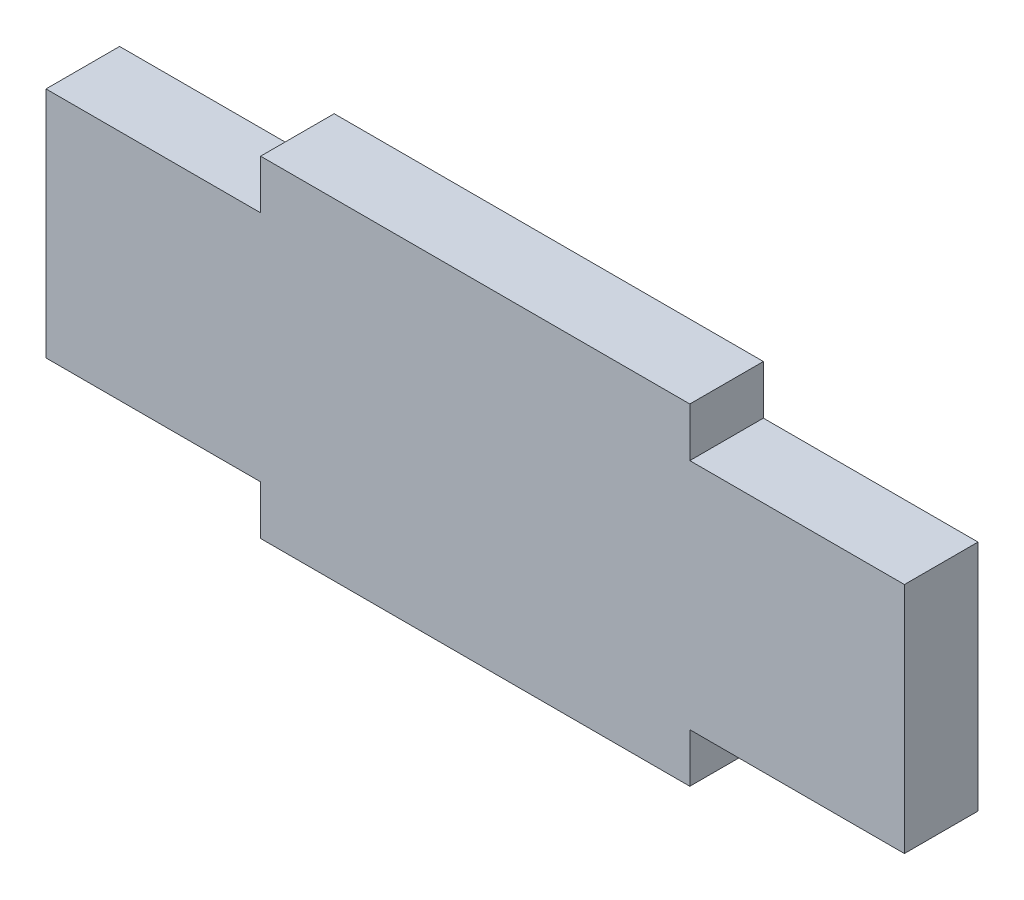
from build123d import *

# Parameters (mm, degrees)
RESSALTO_EXTRUS_O1_DEPTH = 6


with BuildPart() as part:
    # Esboço1 → Ressalto-extrusão1 (new body)
    with BuildSketch(Plane.XY):
        Polygon((-35, 9.5), (-35, -9.5), (-17.5, -9.5), (-17.5, -13.5), (17.5, -13.5), (17.5, -9.5), (35, -9.5), (35, 9.5), (17.5, 9.5), (17.5, 13.5), (-17.5, 13.5), (-17.5, 9.5), align=None)
    extrude(amount=RESSALTO_EXTRUS_O1_DEPTH)


solid = part.part
